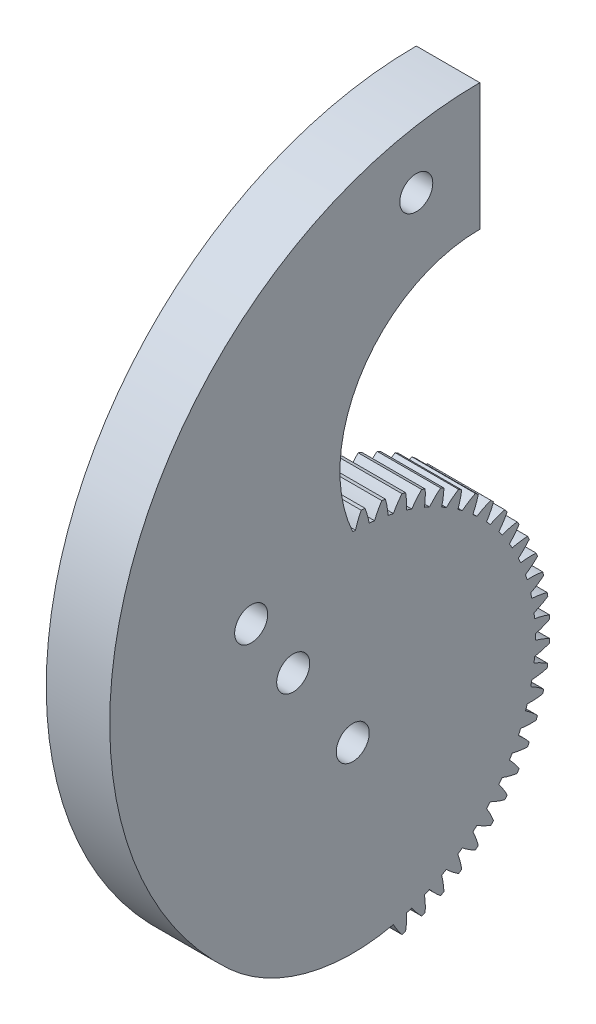
from build123d import *

# Parameters (mm, degrees)
BASPROSKE_W                 = 5
BASPROSKE_H                 = 15.5255
TOOTHCUT_DEPTH              = 23.518487971
TEETHCUTS_COUNT             = 60
TEETHCUTS_ANGLE             = 354
BORSKE_R                    = 1.3
BORE_DEPTH                  = 50.0000508
WYTNIJ_WYCI_GNI_CIE1_START  = -6
WYTNIJ_WYCI_GNI_CIE1_DEPTH  = 7
DODANIE_WYCI_GNI_CIE1_DEPTH = 5
OTW_R_POD_RUB_M21_D         = 2.6
OTW_R_POD_RUB_M22_D         = 2.6
SZKIC8_R                    = 3.4
WYTNIJ_WYCI_GNI_CIE2_DEPTH  = 2


with BuildPart() as part:
    # BasProSke → Base-Revolve (revolve)
    with BuildSketch(Plane(origin=(0, 0, 0), x_dir=(1, 0, 0), z_dir=(0, 1, 0)), mode=Mode.PRIVATE) as base_revolve_sk:
        with Locations((2.5, 7.76275)):
            Rectangle(BASPROSKE_W, BASPROSKE_H)
    revolve(base_revolve_sk.sketch.rotate(Axis((-10, 0, 0), (1, 0, 0)), 180), axis=Axis((-10, 0, 0), (1, 0, 0)))

    # TooCutSke → ToothCut (cut, through all)
    with BuildSketch(Plane(origin=(0, 0, 0), x_dir=(0, 0, -1), z_dir=(1, 0, 0))):
        with BuildLine():
            ThreePointArc((0.215324232, 14.372387118), (0, 14.374), (-0.215324232, 14.372387118))
            ThreePointArc((-0.215324232, 14.372387118), (-0.41015588, 14.95330718), (-0.663217931, 15.511327868))
            ThreePointArc((-0.663217931, 15.511327868), (0, 15.5255), (0.663217931, 15.511327868))
            ThreePointArc((0.663217931, 15.511327868), (0.41015588, 14.95330718), (0.215324232, 14.372387118))
        make_face()
    toothcut = extrude(amount=TOOTHCUT_DEPTH, mode=Mode.SUBTRACT)

    # TeethCuts: ToothCut ×60 about axis
    teethcuts_axis = Axis((-10, 0, 0), (1, 0, 0))
    for i in range(1, TEETHCUTS_COUNT):
        add(toothcut.rotate(teethcuts_axis, i * TEETHCUTS_ANGLE / (TEETHCUTS_COUNT - 1)), mode=Mode.SUBTRACT)

    # BorSke → Bore (cut, symmetric)
    with BuildSketch(Plane(origin=(0, 0, 0), x_dir=(0, 0, -1), z_dir=(1, 0, 0))):
        with Locations(Location((0, 0, 0), (0, 0, 180))):
            Circle(BORSKE_R)
    extrude(amount=BORE_DEPTH, both=True, mode=Mode.SUBTRACT)

    # Wytnij-wyciągnięcie1: read off the stored shape, not the designer's step
    # Wytnij-wyciągnięcie1 outline → Wytnij-wyciągnięcie1 (cut)
    with BuildSketch(Plane(origin=(5, 0, 0), x_dir=(0, 0, -1), z_dir=(1, 0, 0)).offset(WYTNIJ_WYCI_GNI_CIE1_START)):
        with BuildLine():
            ThreePointArc((2.576261376, -15.3102589), (2.707774389, -14.711817744), (2.777568425, -14.103084402))
            ThreePointArc((2.777568425, -14.103084402), (2.248589, -14.197032207), (1.716468203, -14.271146166))
            ThreePointArc((1.716468203, -14.271146166), (1.970955224, -14.828518435), (2.280960019, -15.35703004))
            ThreePointArc((2.280960019, -15.35703004), (2.428723287, -15.334355332), (2.576261376, -15.3102589))
        make_face()
        with BuildLine():
            ThreePointArc((-0.961790512, 15.495680342), (-1.155137217, 14.914264363), (-1.288178875, 14.316161189))
            ThreePointArc((-1.288178875, 14.316161189), (-0.752277035, 14.354300932), (-0.215324232, 14.372387118))
            ThreePointArc((-0.215324232, 14.372387118), (-0.41015588, 14.95330718), (-0.663217931, 15.511327868))
            ThreePointArc((-0.663217931, 15.511327868), (-0.812541889, 15.504222842), (-0.961790512, 15.495680342))
        make_face()
        with BuildLine():
            ThreePointArc((-2.576261376, 15.3102589), (-2.707774389, 14.711817744), (-2.777568425, 14.103084402))
            ThreePointArc((-2.777568425, 14.103084402), (-2.248589, 14.197032208), (-1.716468203, 14.271146166))
            ThreePointArc((-1.716468203, 14.271146166), (-1.970955224, 14.828518435), (-2.280960019, 15.35703004))
            ThreePointArc((-2.280960019, 15.35703004), (-2.428723287, 15.334355332), (-2.576261376, 15.3102589))
        make_face()
        with BuildLine():
            ThreePointArc((-4.162506182, 14.957095057), (-4.230744618, 14.348185371), (-4.236526355, 13.735491271))
            ThreePointArc((-4.236526355, 13.735491271), (-3.720264954, 13.884217827), (-3.198806188, 14.013547551))
            ThreePointArc((-3.198806188, 14.013547551), (-3.51016037, 14.541265339), (-3.873711432, 15.034477377))
            ThreePointArc((-3.873711432, 15.034477377), (-4.018295085, 14.996481416), (-4.162506182, 14.957095057))
        make_face()
        with BuildLine():
            ThreePointArc((-5.703145698, 14.440058151), (-5.707361924, 13.827351277), (-5.649068015, 13.217409223))
            ThreePointArc((-5.649068015, 13.217409223), (-5.151180907, 13.41928505), (-4.646097384, 13.602413576))
            ThreePointArc((-4.646097384, 13.602413576), (-5.010907464, 14.094695096), (-5.424021651, 14.547203834))
            ThreePointArc((-5.424021651, 14.547203834), (-5.5638416, 14.494302912), (-5.703145698, 14.440058151))
        make_face()
        with BuildLine():
            ThreePointArc((-7.181300358, 13.764812945), (-7.121448178, 13.155021829), (-6.999717304, 12.554514474))
            ThreePointArc((-6.999717304, 12.554514474), (-6.525659443, 12.807327779), (-6.042484964, 13.042248712))
            ThreePointArc((-6.042484964, 13.042248712), (-6.456754007, 13.493700425), (-6.914905155, 13.900548081))
            ThreePointArc((-6.914905155, 13.900548081), (-7.048429504, 13.833321791), (-7.181300358, 13.764812945))
        make_face()
        with BuildLine():
            ThreePointArc((-8.580775187, 12.938757569), (-8.457510356, 12.338563208), (-8.273676225, 11.754069837))
            ThreePointArc((-8.273676225, 11.754069837), (-7.828641489, 12.055050744), (-7.372669814, 12.339190241))
            ThreePointArc((-7.372669814, 12.339190241), (-7.831859002, 12.744865948), (-8.33002751, 13.101595015))
            ThreePointArc((-8.33002751, 13.101595015), (-8.455793338, 13.020779903), (-8.580775187, 12.938757569))
        make_face()
        with BuildLine():
            ThreePointArc((-9.886237248, 11.970942458), (-9.70091028, 11.386920708), (-9.456987018, 10.824845151))
            ThreePointArc((-9.456987018, 10.824845151), (-9.045851301, 11.17069605), (-8.622078152, 11.50094102))
            ThreePointArc((-8.622078152, 11.50094102), (-9.121156511, 11.856396053), (-9.653884341, 12.159098132))
            ThreePointArc((-9.653884341, 12.159098132), (-9.770513731, 12.065579625), (-9.886237248, 11.970942458))
        make_face()
        with BuildLine():
            ThreePointArc((-11.083383625, 10.871971195), (-10.838025002, 10.31052072), (-10.536685082, 9.777021196))
            ThreePointArc((-10.536685082, 9.777021196), (-10.163952873, 10.163952873), (-9.777021196, 10.536685082))
            ThreePointArc((-9.777021196, 10.536685082), (-10.31052072, 10.838025002), (-10.871971195, 11.083383625))
            ThreePointArc((-10.871971195, 11.083383625), (-10.978186331, 10.978186331), (-11.083383625, 10.871971195))
        make_face()
        with BuildLine():
            ThreePointArc((-12.159098132, 9.653884341), (-11.856396053, 9.121156511), (-11.50094102, 8.622078152))
            ThreePointArc((-11.50094102, 8.622078152), (-11.17069605, 9.045851301), (-10.824845151, 9.456987018))
            ThreePointArc((-10.824845151, 9.456987018), (-11.386920708, 9.70091028), (-11.970942458, 9.886237248))
            ThreePointArc((-11.970942458, 9.886237248), (-12.065579625, 9.770513731), (-12.159098132, 9.653884341))
        make_face()
        with BuildLine():
            ThreePointArc((-13.101595015, 8.33002751), (-12.744865948, 7.831859002), (-12.339190241, 7.372669814))
            ThreePointArc((-12.339190241, 7.372669814), (-12.055050744, 7.828641489), (-11.754069837, 8.273676225))
            ThreePointArc((-11.754069837, 8.273676225), (-12.338563208, 8.457510356), (-12.938757569, 8.580775187))
            ThreePointArc((-12.938757569, 8.580775187), (-13.020779903, 8.455793338), (-13.101595015, 8.33002751))
        make_face()
        with BuildLine():
            ThreePointArc((-13.900548081, 6.914905155), (-13.493700425, 6.456754007), (-13.042248712, 6.042484964))
            ThreePointArc((-13.042248712, 6.042484964), (-12.807327779, 6.525659443), (-12.554514474, 6.999717304))
            ThreePointArc((-12.554514474, 6.999717304), (-13.155021829, 7.121448178), (-13.764812945, 7.181300358))
            ThreePointArc((-13.764812945, 7.181300358), (-13.833321791, 7.048429504), (-13.900548081, 6.914905155))
        make_face()
        with BuildLine():
            ThreePointArc((-14.547203834, 5.424021651), (-14.094695096, 5.010907464), (-13.602413576, 4.646097384))
            ThreePointArc((-13.602413576, 4.646097384), (-13.41928505, 5.151180907), (-13.217409223, 5.649068015))
            ThreePointArc((-13.217409223, 5.649068015), (-13.827351277, 5.707361924), (-14.440058151, 5.703145698))
            ThreePointArc((-14.440058151, 5.703145698), (-14.494302912, 5.5638416), (-14.547203834, 5.424021651))
        make_face()
        with BuildLine():
            ThreePointArc((-15.034477377, 3.873711432), (-14.541265339, 3.51016037), (-14.013547551, 3.198806188))
            ThreePointArc((-14.013547551, 3.198806188), (-13.884217827, 3.720264954), (-13.735491271, 4.236526355))
            ThreePointArc((-13.735491271, 4.236526355), (-14.348185371, 4.230744618), (-14.957095057, 4.162506182))
            ThreePointArc((-14.957095057, 4.162506182), (-14.996481416, 4.018295085), (-15.034477377, 3.873711432))
        make_face()
        with BuildLine():
            ThreePointArc((-15.35703004, 2.280960019), (-14.828518435, 1.970955224), (-14.271146167, 1.716468203))
            ThreePointArc((-14.271146167, 1.716468203), (-14.197032208, 2.248589), (-14.103084402, 2.777568425))
            ThreePointArc((-14.103084402, 2.777568425), (-14.711817744, 2.707774389), (-15.3102589, 2.576261376))
            ThreePointArc((-15.3102589, 2.576261376), (-15.334355332, 2.428723287), (-15.35703004, 2.280960019))
        make_face()
        with BuildLine():
            ThreePointArc((-15.511327868, 0.663217931), (-14.95330718, 0.41015588), (-14.372387118, 0.215324232))
            ThreePointArc((-14.372387118, 0.215324232), (-14.354300933, 0.752277035), (-14.316161189, 1.288178875))
            ThreePointArc((-14.316161189, 1.288178875), (-14.914264363, 1.155137217), (-15.495680342, 0.961790512))
            ThreePointArc((-15.495680342, 0.961790512), (-15.504222842, 0.812541889), (-15.511327868, 0.663217931))
        make_face()
        with BuildLine():
            ThreePointArc((-15.495680342, -0.961790512), (-14.914264363, -1.155137217), (-14.316161189, -1.288178875))
            ThreePointArc((-14.316161189, -1.288178875), (-14.354300933, -0.752277035), (-14.372387118, -0.215324232))
            ThreePointArc((-14.372387118, -0.215324232), (-14.95330718, -0.41015588), (-15.511327868, -0.663217931))
            ThreePointArc((-15.511327868, -0.663217931), (-15.504222842, -0.812541889), (-15.495680342, -0.961790512))
        make_face()
        with BuildLine():
            ThreePointArc((-15.3102589, -2.576261376), (-14.711817744, -2.707774389), (-14.103084402, -2.777568425))
            ThreePointArc((-14.103084402, -2.777568425), (-14.197032208, -2.248589), (-14.271146167, -1.716468203))
            ThreePointArc((-14.271146167, -1.716468203), (-14.828518435, -1.970955224), (-15.35703004, -2.280960019))
            ThreePointArc((-15.35703004, -2.280960019), (-15.334355332, -2.428723287), (-15.3102589, -2.576261376))
        make_face()
        with BuildLine():
            ThreePointArc((-14.957095057, -4.162506182), (-14.348185371, -4.230744618), (-13.735491271, -4.236526355))
            ThreePointArc((-13.735491271, -4.236526355), (-13.884217827, -3.720264954), (-14.013547551, -3.198806188))
            ThreePointArc((-14.013547551, -3.198806188), (-14.541265339, -3.51016037), (-15.034477377, -3.873711432))
            ThreePointArc((-15.034477377, -3.873711432), (-14.996481416, -4.018295085), (-14.957095057, -4.162506182))
        make_face()
        with BuildLine():
            ThreePointArc((-14.440058151, -5.703145698), (-13.827351277, -5.707361924), (-13.217409223, -5.649068015))
            ThreePointArc((-13.217409223, -5.649068015), (-13.41928505, -5.151180907), (-13.602413576, -4.646097384))
            ThreePointArc((-13.602413576, -4.646097384), (-14.094695096, -5.010907464), (-14.547203834, -5.424021651))
            ThreePointArc((-14.547203834, -5.424021651), (-14.494302912, -5.5638416), (-14.440058151, -5.703145698))
        make_face()
        with BuildLine():
            ThreePointArc((-13.764812945, -7.181300358), (-13.155021829, -7.121448178), (-12.554514474, -6.999717304))
            ThreePointArc((-12.554514474, -6.999717304), (-12.807327779, -6.525659443), (-13.042248712, -6.042484964))
            ThreePointArc((-13.042248712, -6.042484964), (-13.493700425, -6.456754007), (-13.900548081, -6.914905155))
            ThreePointArc((-13.900548081, -6.914905155), (-13.833321791, -7.048429504), (-13.764812945, -7.181300358))
        make_face()
        with BuildLine():
            ThreePointArc((-12.938757569, -8.580775187), (-12.338563208, -8.457510356), (-11.754069837, -8.273676225))
            ThreePointArc((-11.754069837, -8.273676225), (-12.055050744, -7.828641489), (-12.339190241, -7.372669814))
            ThreePointArc((-12.339190241, -7.372669814), (-12.744865948, -7.831859002), (-13.101595015, -8.33002751))
            ThreePointArc((-13.101595015, -8.33002751), (-13.020779903, -8.455793338), (-12.938757569, -8.580775187))
        make_face()
        with BuildLine():
            ThreePointArc((-11.970942458, -9.886237248), (-11.386920708, -9.70091028), (-10.824845151, -9.456987018))
            ThreePointArc((-10.824845151, -9.456987018), (-11.17069605, -9.045851301), (-11.50094102, -8.622078152))
            ThreePointArc((-11.50094102, -8.622078152), (-11.856396053, -9.121156511), (-12.159098132, -9.653884341))
            ThreePointArc((-12.159098132, -9.653884341), (-12.065579625, -9.770513731), (-11.970942458, -9.886237248))
        make_face()
        with BuildLine():
            ThreePointArc((-10.871971195, -11.083383625), (-10.31052072, -10.838025002), (-9.777021196, -10.536685082))
            ThreePointArc((-9.777021196, -10.536685082), (-10.163952873, -10.163952873), (-10.536685082, -9.777021196))
            ThreePointArc((-10.536685082, -9.777021196), (-10.838025002, -10.31052072), (-11.083383625, -10.871971195))
            ThreePointArc((-11.083383625, -10.871971195), (-10.978186331, -10.978186331), (-10.871971195, -11.083383625))
        make_face()
        with BuildLine():
            ThreePointArc((-9.653884341, -12.159098132), (-9.121156511, -11.856396053), (-8.622078152, -11.50094102))
            ThreePointArc((-8.622078152, -11.50094102), (-9.045851301, -11.17069605), (-9.456987018, -10.824845151))
            ThreePointArc((-9.456987018, -10.824845151), (-9.70091028, -11.386920708), (-9.886237248, -11.970942458))
            ThreePointArc((-9.886237248, -11.970942458), (-9.770513731, -12.065579625), (-9.653884341, -12.159098132))
        make_face()
        with BuildLine():
            ThreePointArc((-8.33002751, -13.101595015), (-7.831859002, -12.744865948), (-7.372669814, -12.339190241))
            ThreePointArc((-7.372669814, -12.339190241), (-7.828641489, -12.055050744), (-8.273676225, -11.754069837))
            ThreePointArc((-8.273676225, -11.754069837), (-8.457510356, -12.338563208), (-8.580775187, -12.938757569))
            ThreePointArc((-8.580775187, -12.938757569), (-8.455793338, -13.020779903), (-8.33002751, -13.101595015))
        make_face()
        with BuildLine():
            ThreePointArc((-6.914905155, -13.900548081), (-6.456754007, -13.493700425), (-6.042484964, -13.042248712))
            ThreePointArc((-6.042484964, -13.042248712), (-6.525659443, -12.807327779), (-6.999717304, -12.554514473))
            ThreePointArc((-6.999717304, -12.554514473), (-7.121448178, -13.155021829), (-7.181300358, -13.764812945))
            ThreePointArc((-7.181300358, -13.764812945), (-7.048429504, -13.833321791), (-6.914905155, -13.900548081))
        make_face()
        with BuildLine():
            ThreePointArc((-5.424021651, -14.547203834), (-5.010907464, -14.094695096), (-4.646097384, -13.602413576))
            ThreePointArc((-4.646097384, -13.602413576), (-5.151180907, -13.41928505), (-5.649068015, -13.217409223))
            ThreePointArc((-5.649068015, -13.217409223), (-5.707361924, -13.827351277), (-5.703145698, -14.440058151))
            ThreePointArc((-5.703145698, -14.440058151), (-5.5638416, -14.494302912), (-5.424021651, -14.547203834))
        make_face()
        with BuildLine():
            ThreePointArc((-3.873711432, -15.034477377), (-3.51016037, -14.541265339), (-3.198806188, -14.013547551))
            ThreePointArc((-3.198806188, -14.013547551), (-3.720264954, -13.884217827), (-4.236526355, -13.73549127))
            ThreePointArc((-4.236526355, -13.73549127), (-4.230744618, -14.348185371), (-4.162506182, -14.957095057))
            ThreePointArc((-4.162506182, -14.957095057), (-4.018295085, -14.996481416), (-3.873711432, -15.034477377))
        make_face()
        with BuildLine():
            ThreePointArc((-2.280960019, -15.35703004), (-1.970955224, -14.828518435), (-1.716468203, -14.271146167))
            ThreePointArc((-1.716468203, -14.271146167), (-2.248589, -14.197032208), (-2.777568425, -14.103084402))
            ThreePointArc((-2.777568425, -14.103084402), (-2.707774389, -14.711817744), (-2.576261376, -15.3102589))
            ThreePointArc((-2.576261376, -15.3102589), (-2.428723287, -15.334355332), (-2.280960019, -15.35703004))
        make_face()
        with BuildLine():
            ThreePointArc((-0.663217931, -15.511327868), (-0.41015588, -14.95330718), (-0.215324232, -14.372387118))
            ThreePointArc((-0.215324232, -14.372387118), (-0.752277035, -14.354300932), (-1.288178875, -14.316161189))
            ThreePointArc((-1.288178875, -14.316161189), (-1.155137217, -14.914264363), (-0.961790512, -15.495680342))
            ThreePointArc((-0.961790512, -15.495680342), (-0.812541889, -15.504222842), (-0.663217931, -15.511327868))
        make_face()
        with BuildLine():
            ThreePointArc((0.961790512, -15.495680342), (1.155137217, -14.914264363), (1.288178875, -14.316161189))
            ThreePointArc((1.288178875, -14.316161189), (0.752277035, -14.354300932), (0.215324232, -14.372387118))
            ThreePointArc((0.215324232, -14.372387118), (0.41015588, -14.95330718), (0.663217931, -15.511327868))
            ThreePointArc((0.663217931, -15.511327868), (0.812541889, -15.504222842), (0.961790512, -15.495680342))
        make_face()
    extrude(amount=WYTNIJ_WYCI_GNI_CIE1_DEPTH, mode=Mode.SUBTRACT)

    # Szkic2 → Dodanie-wyciągnięcie1 (add)
    with BuildSketch(Plane(origin=(0, 0, 0), x_dir=(0, 0, -1), z_dir=(1, 0, 0))):
        with BuildLine():
            Line((10, 30), (10, 40))
            ThreePointArc((10, 40), (-17.14458223, 21.45445096), (-9.735749403, -10.57483142))
            ThreePointArc((-9.735749403, -10.57483142), (-13.390565762, 5.225382721), (0, 14.374))
            ThreePointArc((0, 14.374), (0.724065061, 24.92342323), (10, 30))
        make_face()
    extrude(amount=DODANIE_WYCI_GNI_CIE1_DEPTH)

    # Otwór pod śrubę M21 (through all)
    with Locations(Plane(origin=(5, 0, 0), x_dir=(0, 0, -1), z_dir=(1, 0, 0))):
        with Locations((5, 35)):
            Hole(OTW_R_POD_RUB_M21_D / 2)

    # Otwór pod śrubę M22 (through all)
    with Locations(Plane(origin=(5, 0, 0), x_dir=(0, 0, -1), z_dir=(1, 0, 0))):
        with Locations((-8, 12.093386622), (-4.689655172, 7.089226641)):
            Hole(OTW_R_POD_RUB_M22_D / 2)

    # Szkic8 → Wytnij-wyciągnięcie2 (cut)
    with BuildSketch(Plane(origin=(0, 0, 0), x_dir=(0, 0, -1), z_dir=(1, 0, 0))):
        Circle(SZKIC8_R)
    extrude(amount=WYTNIJ_WYCI_GNI_CIE2_DEPTH, mode=Mode.SUBTRACT)


solid = part.part
